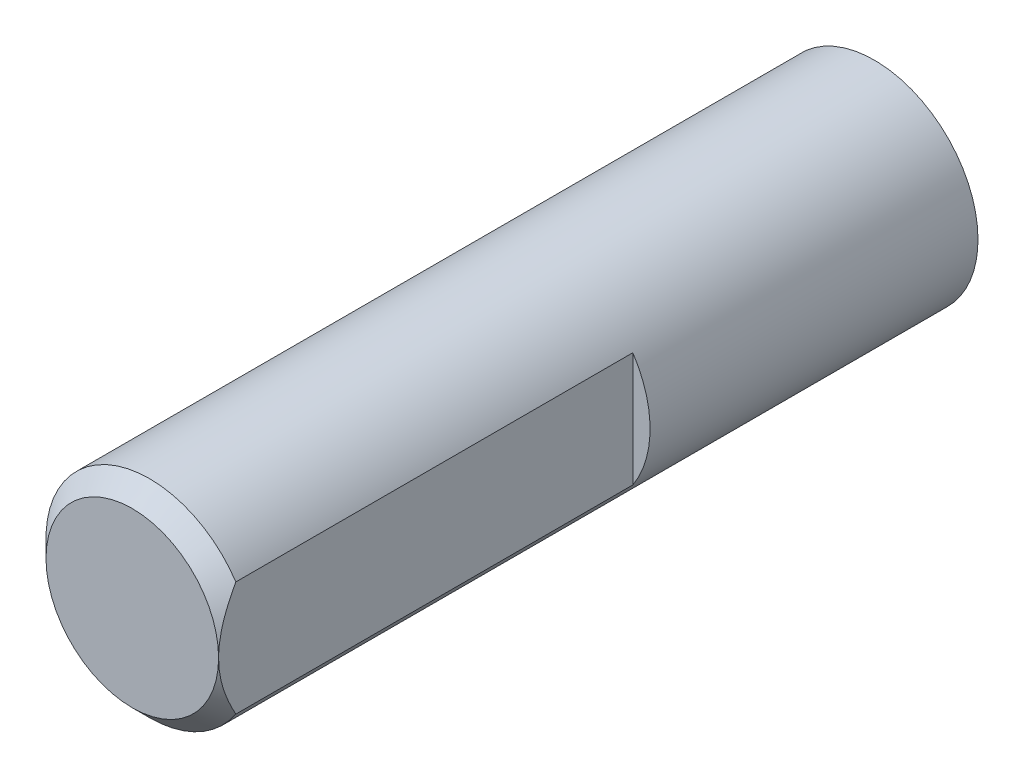
from build123d import *

# Parameters (mm, degrees)
SKETCH1_R           = 3
BOSS_EXTRUDE1_DEPTH = 21.5
CUT_EXTRUDE1_START  = -12
CUT_EXTRUDE1_DEPTH  = 12
CHAMFER1_SIZE       = 0.5


with BuildPart() as part:
    # Sketch1 → Boss-Extrude1 (new body)
    with BuildSketch(Plane.XY):
        Circle(SKETCH1_R)
    extrude(amount=BOSS_EXTRUDE1_DEPTH)

    # Sketch2 → Cut-Extrude1 (cut)
    with BuildSketch(Plane.XY.offset(21.5).offset(CUT_EXTRUDE1_START)):
        with BuildLine():
            Line((2.5, 1.658312395), (2.5, -1.658312395))
            ThreePointArc((2.5, -1.658312395), (3, 0), (2.5, 1.658312395))
        make_face()
    extrude(amount=CUT_EXTRUDE1_DEPTH, mode=Mode.SUBTRACT)

    # Chamfer1
    chamfer1_edges = [part.edges().sort_by_distance(p)[0] for p in [
        (-3, 0, 21.5),
    ]]
    chamfer(chamfer1_edges, length=CHAMFER1_SIZE - 0.0001)  # a hair under: the kernel refuses the full size


solid = part.part
